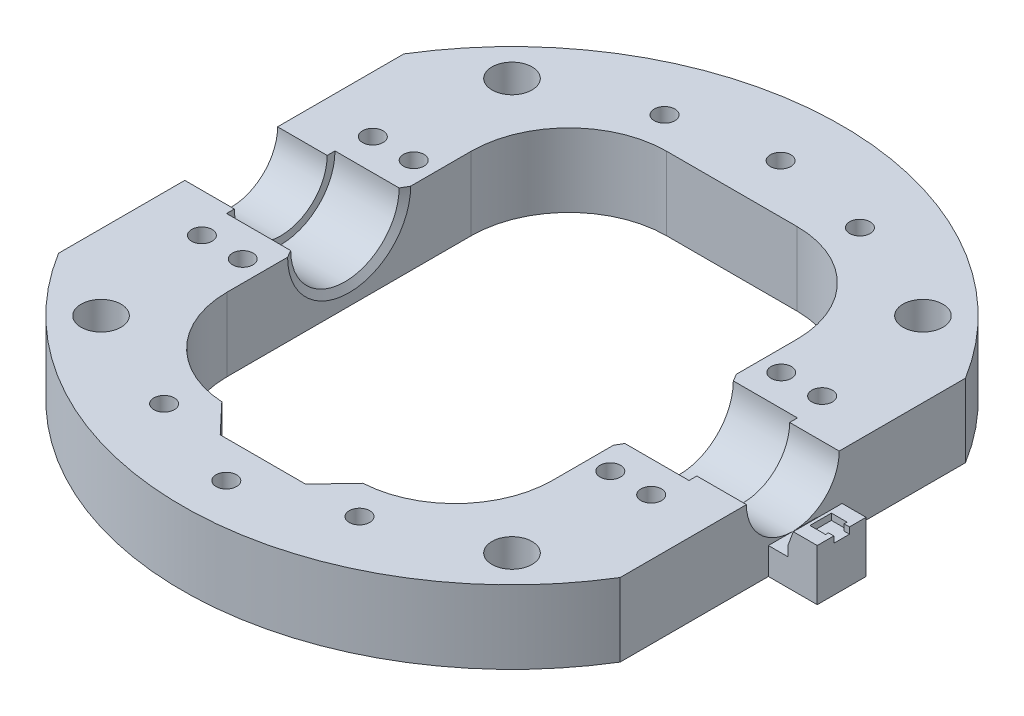
from build123d import *
from OCP.BRepFilletAPI import BRepFilletAPI_MakeChamfer

# Parameters (mm, degrees)
SKETCH2_R               = 67.5
SKETCH2_W               = 66.7
SKETCH2_H               = 90
BOSS_EXTRUDE1_DEPTH     = 15
SKETCH7_W               = 14
SKETCH7_H               = 11.1
CUT_EXTRUDE1_DEPTH      = 135.058839694
CUT_EXTRUDE1_DEPTH_BACK = 135.058839694
SKETCH8_R               = 9.5
FILLET1_R               = 20
SKETCH9_R               = 2.1
CUT_EXTRUDE2_DEPTH      = 97.630740606
CHAMFER1_SIZE           = 1.5
CHAMFER1_SIZE2          = 0.866025404
SKETCH10_R              = 4.1
CUT_EXTRUDE3_DEPTH      = 97.630740606
CUT_EXTRUDE4_DEPTH      = 97.630740606
SKETCH12_W              = 10
SKETCH12_H              = 5.5
BOSS_EXTRUDE2_DEPTH     = 10
BOSS_EXTRUDE3_START     = 4
SKETCH14_W              = 10
SKETCH14_H              = 3.7
BOSS_EXTRUDE3_DEPTH     = 6
BOSS_EXTRUDE4_DEPTH     = 1.3
CHAMFER2_SIZE           = 3
CHAMFER2_SIZE2          = 1.091910703
SKETCH16_W              = 10
SKETCH16_H              = 6
CUT_EXTRUDE5_DEPTH      = 97.630740606
CHAMFER3_START          = -1
CHAMFER3_DEPTH          = 16
CUT_EXTRUDE6_DEPTH      = 97.630740606


with BuildPart() as part:
    # Sketch2 → Boss-Extrude1 (new body)
    with BuildSketch(Plane(origin=(0, 0, 0), x_dir=(1, 0, 0), z_dir=(0, 1, 0))):
        with Locations(Location((0, 0, 0), (0, 0, 270))):
            Circle(SKETCH2_R)
        Rectangle(SKETCH2_W, SKETCH2_H, mode=Mode.SUBTRACT)
    extrude(amount=BOSS_EXTRUDE1_DEPTH)

    # Sketch7 → Cut-Revolve2 (revolve, cut)
    with BuildSketch(Plane(origin=(0, 15, 0), x_dir=(1, 0, 0), z_dir=(0, 1, 0))):
        with Locations((-40.35, 5.55)):
            Rectangle(SKETCH7_W, SKETCH7_H)
        with Locations((40.35, 5.55)):
            Rectangle(SKETCH7_W, SKETCH7_H)
    revolve(axis=Axis((67.5, 15, 0), (-1, 0, 0)), mode=Mode.SUBTRACT)

    # Sketch8 → Cut-Extrude1 (cut, two sides: drawn at the far end of the back side and taken through both)
    with BuildSketch(Plane.ZY.offset(-47.35).offset(-CUT_EXTRUDE1_DEPTH_BACK)):
        with Locations((0, 15)):
            Circle(SKETCH8_R)
    extrude(amount=CUT_EXTRUDE1_DEPTH + CUT_EXTRUDE1_DEPTH_BACK, mode=Mode.SUBTRACT)

    # Fillet1
    fillet1_edges = [part.edges().sort_by_distance(p)[0] for p in [
        (-33.35, 7.5, -45),
        (-33.35, 7.5, 45),
        (33.35, 7.5, 45),
        (33.35, 7.5, -45),
    ]]
    fillet(fillet1_edges, radius=FILLET1_R)

    # Sketch9 → Cut-Extrude2 (cut, through all)
    with BuildSketch(Plane(origin=(0, 15, 0), x_dir=(1, 0, 0), z_dir=(0, 1, 0))):
        with Locations(Location((-37.629775444, 17.5, 0), (0, 0, 270))):
            Circle(SKETCH9_R)
        with Locations(Location((37.629775444, 17.5, 0), (0, 0, 270))):
            Circle(SKETCH9_R)
        with Locations(Location((37.629775444, -17.5, 0), (0, 0, 270))):
            Circle(SKETCH9_R)
        with Locations(Location((-37.629775444, -17.5, 0), (0, 0, 270))):
            Circle(SKETCH9_R)
        with Locations(Location((-20, 51.23475383, 0), (0, 0, 270))):
            Circle(SKETCH9_R)
        with Locations(Location((20, 51.23475383, 0), (0, 0, 270))):
            Circle(SKETCH9_R)
        with Locations(Location((20, -51.23475383, 0), (0, 0, 270))):
            Circle(SKETCH9_R)
        with Locations(Location((-20, -51.23475383, 0), (0, 0, 270))):
            Circle(SKETCH9_R)
        with Locations(Location((0, 55, 0), (0, 0, 270))):
            Circle(SKETCH9_R)
        with Locations(Location((0, -58.5, 0), (0, 0, 270))):
            Circle(SKETCH9_R)
        with Locations(Location((46, 17.5, 0), (0, 0, 270))):
            Circle(SKETCH9_R)
        with Locations(Location((46, -17.5, 0), (0, 0, 270))):
            Circle(SKETCH9_R)
        with Locations(Location((-46, 17.5, 0), (0, 0, 270))):
            Circle(SKETCH9_R)
        with Locations(Location((-46, -17.5, 0), (0, 0, 270))):
            Circle(SKETCH9_R)
    extrude(amount=-CUT_EXTRUDE2_DEPTH, mode=Mode.SUBTRACT)

    # Chamfer1: one chamfer whose edges measure the first distance from different faces: ONE call of the kernel's chamfer builder (chamfer() names one face for all edges)
    chamfer1_edges_1 = [part.edges().sort_by_distance(p)[0] for p in [
        (-33.35, 3.9, 0),
    ]]
    chamfer1_side_1 = [part.faces().sort_by_distance(p)[0] for p in [
        (-33.35, 0.522015325, 0),
    ]]
    chamfer1_edges_2 = [part.edges().sort_by_distance(p)[0] for p in [
        (33.35, 3.9, 0),
    ]]
    chamfer1_side_2 = [part.faces().sort_by_distance(p)[0] for p in [
        (33.35, 0.522015325, 0),
    ]]
    chamfer1 = BRepFilletAPI_MakeChamfer(part.part.solid().wrapped)
    for e in chamfer1_edges_1:
        chamfer1.Add(CHAMFER1_SIZE, CHAMFER1_SIZE2, e.wrapped, chamfer1_side_1[0].wrapped)  # the first distance lies on this face
    for e in chamfer1_edges_2:
        chamfer1.Add(CHAMFER1_SIZE, CHAMFER1_SIZE2, e.wrapped, chamfer1_side_2[0].wrapped)  # the first distance lies on this face
    add(Compound.cast(chamfer1.Shape()), mode=Mode.REPLACE)

    # Sketch10 → Cut-Extrude3 (cut, through all)
    with BuildSketch(Plane.XZ):
        with Locations(Location((42.072853481, -42.072853481, 0), (0, 0, 270))):
            Circle(SKETCH10_R)
        with Locations(Location((-42.072853481, -42.072853481, 0), (0, 0, 270))):
            Circle(SKETCH10_R)
        with Locations(Location((-42.072853481, 42.072853481, 0), (0, 0, 270))):
            Circle(SKETCH10_R)
        with Locations(Location((42.072853481, 42.072853481, 0), (0, 0, 270))):
            Circle(SKETCH10_R)
    extrude(amount=-CUT_EXTRUDE3_DEPTH, mode=Mode.SUBTRACT)

    # Sketch11 → Cut-Extrude4 (cut, through all)
    with BuildSketch(Plane.XZ):
        with BuildLine():
            Line((57.5, -35.355339059), (57.5, 35.355339059))
            ThreePointArc((57.5, 35.355339059), (67.5, 0), (57.5, -35.355339059))
        make_face()
    extrude(amount=-CUT_EXTRUDE4_DEPTH, mode=Mode.SUBTRACT)

    # Sketch12 → Boss-Extrude2 (add)
    with BuildSketch(Plane(origin=(57.5, 0, 0), x_dir=(0, 0, -1), z_dir=(1, 0, 0))):
        with Locations((0, 2.75)):
            Rectangle(SKETCH12_W, SKETCH12_H)
    extrude(amount=BOSS_EXTRUDE2_DEPTH)

    # Sketch14 → Boss-Extrude3 (add)
    with BuildSketch(Plane(origin=(57.5, 0, 0), x_dir=(0, 0, -1), z_dir=(1, 0, 0)).offset(BOSS_EXTRUDE3_START)):
        with Locations((0, 7.35)):
            Rectangle(SKETCH14_W, SKETCH14_H)
    extrude(amount=BOSS_EXTRUDE3_DEPTH)

    # Sketch15 → Boss-Extrude4 (add)
    with BuildSketch(Plane(origin=(0, 9.2, 0), x_dir=(1, 0, 0), z_dir=(0, 1, 0))):
        Polygon((66.4, -2.2), (66.4, -1.6), (67.5, -1.6), (67.5, -5), (61.5, -5), (61.5, 5), (67.5, 5), (67.5, 1.6), (66.4, 1.6), (66.4, 2.2), (63.2, 2.2), (63.2, -2.2), align=None)
    extrude(amount=BOSS_EXTRUDE4_DEPTH)

    # Chamfer2
    chamfer2_edges = [part.edges().sort_by_distance(p)[0] for p in [
        (61.5, 10.5, 0),
    ]]
    chamfer2_side = [part.faces().sort_by_distance(p)[0] for p in [
        (61.5, 8, 0),
    ]]
    chamfer(chamfer2_edges, length=CHAMFER2_SIZE, length2=CHAMFER2_SIZE2, reference=chamfer2_side[0])

    # Sketch16 → Cut-Extrude5 (cut, through all)
    with BuildSketch(Plane.XZ):
        with Locations((0, 48)):
            Rectangle(SKETCH16_W, SKETCH16_H)
    extrude(amount=-CUT_EXTRUDE5_DEPTH, mode=Mode.SUBTRACT)

    # Chamfer3: read off the stored shape, not the designer's step
    # Chamfer3 outline → Chamfer3 (cut)
    with BuildSketch(Plane(origin=(0, 0, 0), x_dir=(1, 0, 0), z_dir=(0, 1, 0)).offset(CHAMFER3_START)):
        with BuildLine():
            Line((-14.45, -44.969727089), (-8.74275335, -51))
            Line((-8.74275335, -51), (-5, -51))
            Line((-5, -51), (-5, -45))
            Line((-5, -45), (-13.35, -45))
            ThreePointArc((-13.35, -45), (-13.900208244, -44.99243034), (-14.45, -44.969727089))
        make_face()
        with BuildLine():
            Line((5, -45), (5, -51))
            Line((5, -51), (8.74275335, -51))
            Line((8.74275335, -51), (14.45, -44.969727089))
            ThreePointArc((14.45, -44.969727089), (13.900208244, -44.99243034), (13.35, -45))
            Line((13.35, -45), (5, -45))
        make_face()
    extrude(amount=CHAMFER3_DEPTH, mode=Mode.SUBTRACT)

    # Sketch18 → Cut-Extrude6 (cut, through all)
    with BuildSketch(Plane.XZ):
        with BuildLine():
            Line((-57.5, 35.355339059), (-57.5, -35.355339059))
            ThreePointArc((-57.5, -35.355339059), (-67.5, 0), (-57.5, 35.355339059))
        make_face()
    extrude(amount=-CUT_EXTRUDE6_DEPTH, mode=Mode.SUBTRACT)


solid = part.part
